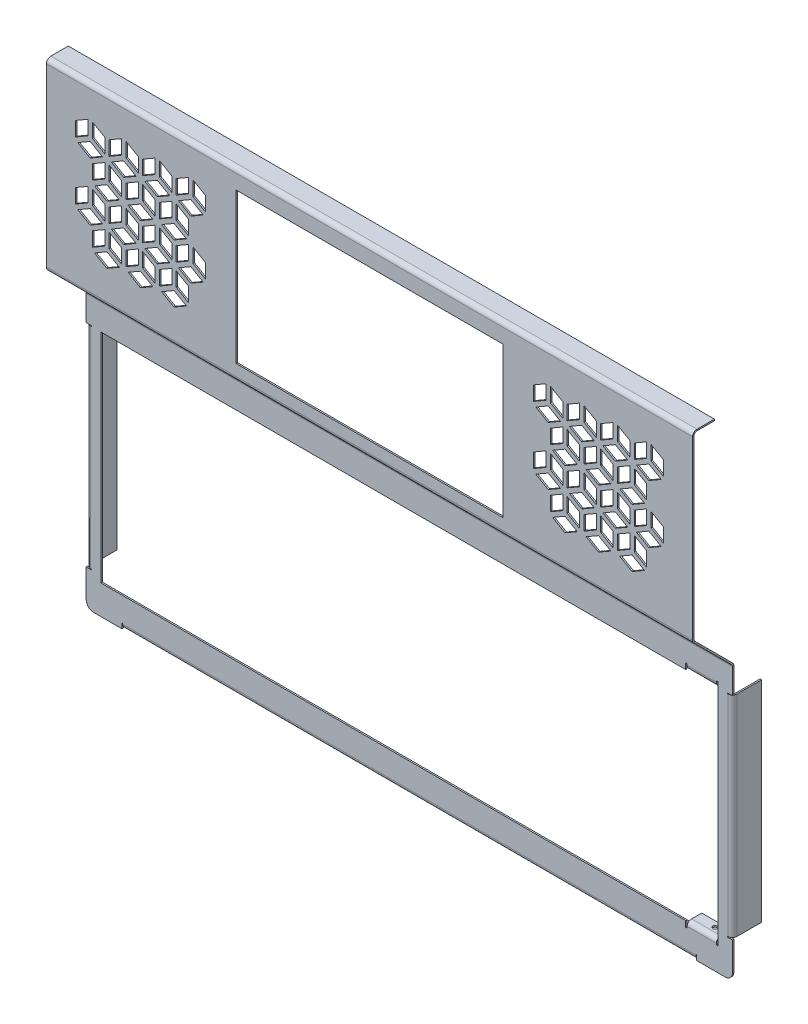
from build123d import *

# Parameters (mm, degrees)
SKETCH1_W                       = 423
SKETCH1_H                       = 149
BASE_FLANGE1_DEPTH              = 1
EDGE_FLANGE2_STRIP_W            = 8
EDGE_FLANGE2_STRIP_H            = 1
EDGE_FLANGE2_STRIP_CUT_DEPTH    = 393
EDGE_FLANGE2_RELIEF_W           = 8.5
EDGE_FLANGE2_RELIEF_H           = 0.5
EDGE_FLANGE2_RELIEF_CUT_DEPTH   = 1
EDGE_FLANGE2_STRIP_2_W          = 8
EDGE_FLANGE2_STRIP_2_H          = 1
EDGE_FLANGE2_STRIP_CUT_2_DEPTH  = 144
EDGE_FLANGE2_RELIEF_2_W         = 8.5
EDGE_FLANGE2_RELIEF_2_H         = 0.5
EDGE_FLANGE2_RELIEF_CUT_2_DEPTH = 1
EDGE_FLANGE2_STRIP_3_W          = 8
EDGE_FLANGE2_STRIP_3_H          = 1
EDGE_FLANGE2_STRIP_CUT_3_DEPTH  = 144
EDGE_FLANGE2_RELIEF_3_W         = 8.5
EDGE_FLANGE2_RELIEF_3_H         = 0.5
EDGE_FLANGE2_RELIEF_CUT_3_DEPTH = 1
EDGE_FLANGE2_DEPTH              = 393
EDGE_FLANGE2_BEND_DEPTH         = 144
EDGE_FLANGE2_BEND_2_DEPTH       = 144
EDGE_FLANGE4_STRIP_W            = 8
EDGE_FLANGE4_STRIP_H            = 1
EDGE_FLANGE4_STRIP_CUT_DEPTH    = 20
EDGE_FLANGE4_RELIEF_W           = 9
EDGE_FLANGE4_RELIEF_H           = 1
EDGE_FLANGE4_RELIEF_CUT_DEPTH   = 1
EDGE_FLANGE4_STRIP_2_W          = 8
EDGE_FLANGE4_STRIP_2_H          = 1
EDGE_FLANGE4_STRIP_CUT_2_DEPTH  = 20
EDGE_FLANGE4_RELIEF_2_W         = 9
EDGE_FLANGE4_RELIEF_2_H         = 1
EDGE_FLANGE4_RELIEF_CUT_2_DEPTH = 1
EDGE_FLANGE4_DEPTH              = 20
EDGE_FLANGE4_BEND_DEPTH         = 20
SKETCH36_R                      = 1.5
CUT_EXTRUDE2_DEPTH              = 458.48230284
EDGE_FLANGE5_START              = -18.747648903
EDGE_FLANGE5_DEPTH              = 443
EDGE_FLANGE5_2_DEPTH            = 443
EDGE_FLANGE6_START              = -18.747648903
EDGE_FLANGE6_DEPTH              = 443
EDGE_FLANGE6_2_DEPTH            = 443
EDGE_FLANGE7_STRIP_W            = 8
EDGE_FLANGE7_STRIP_H            = 1
EDGE_FLANGE7_STRIP_CUT_DEPTH    = 443
EDGE_FLANGE7_DEPTH              = 443
SKETCH60_W                      = 183
SKETCH60_H                      = 103
CUT_EXTRUDE3_DEPTH              = 515.968025923
CUT_EXTRUDE4_DEPTH              = 1


# Read off the part's stored shape, not the designer's step: Edge-Flange5, Edge-Flange6
# Sheet-metal steps are written as plain solids
with BuildPart() as part:
    # Sketch1 → Base-Flange1 (new body)
    with BuildSketch(Plane.XY):
        with BuildLine():
            Line((-18.747648903, 137.168495298), (424.252351097, 137.168495298))
            Line((424.252351097, 137.168495298), (424.252351097, -46.831504702))
            ThreePointArc((424.252351097, -46.831504702), (422.787885003, -50.367038608), (419.252351097, -51.831504702))
            Line((419.252351097, -51.831504702), (-13.747648903, -51.831504702))
            ThreePointArc((-13.747648903, -51.831504702), (-17.283182809, -50.367038608), (-18.747648903, -46.831504702))
            Line((-18.747648903, -46.831504702), (-18.747648903, 137.168495298))
        make_face()
        with Locations((202.752351097, 42.668495298)):
            Rectangle(SKETCH1_W, SKETCH1_H, mode=Mode.SUBTRACT)
    extrude(amount=-BASE_FLANGE1_DEPTH)

    # Edge-Flange2 strip (across the edge) → Edge-Flange2 strip cut (cut)
    with BuildSketch(Plane(origin=(399.252351097, -51.831504702, -1), x_dir=(0, 1, 0), z_dir=(-1, 0, 0))):
        with Locations((-1, -0.5)):
            Rectangle(EDGE_FLANGE2_STRIP_W, EDGE_FLANGE2_STRIP_H)
    extrude(amount=EDGE_FLANGE2_STRIP_CUT_DEPTH, mode=Mode.SUBTRACT)

    # Edge-Flange2 relief (on the sheet) → Edge-Flange2 relief cut (cut)
    with BuildSketch(Plane(origin=(399.252351097, -48.831504702, -1), x_dir=(0, 1, 0), z_dir=(0, 0, -1))):
        with Locations((-3.75, 0.25)):
            Rectangle(EDGE_FLANGE2_RELIEF_W, EDGE_FLANGE2_RELIEF_H)
        with Locations((-3.75, -393.25)):
            Rectangle(EDGE_FLANGE2_RELIEF_W, EDGE_FLANGE2_RELIEF_H)
    extrude(amount=-EDGE_FLANGE2_RELIEF_CUT_DEPTH, mode=Mode.SUBTRACT)

    # Edge-Flange2 strip 2 (across the edge) → Edge-Flange2 strip cut 2 (cut)
    with BuildSketch(Plane(origin=(-18.747648903, -26.831504702, -1), x_dir=(1, 0, 0), z_dir=(0, 1, 0))):
        with Locations((-1, -0.5)):
            Rectangle(EDGE_FLANGE2_STRIP_2_W, EDGE_FLANGE2_STRIP_2_H)
    extrude(amount=EDGE_FLANGE2_STRIP_CUT_2_DEPTH, mode=Mode.SUBTRACT)

    # Edge-Flange2 relief 2 (on the sheet) → Edge-Flange2 relief cut 2 (cut)
    with BuildSketch(Plane(origin=(-15.747648903, -26.831504702, -1), x_dir=(1, 0, 0), z_dir=(0, 0, -1))):
        with Locations((-3.75, 0.25)):
            Rectangle(EDGE_FLANGE2_RELIEF_2_W, EDGE_FLANGE2_RELIEF_2_H)
        with Locations((-3.75, -144.25)):
            Rectangle(EDGE_FLANGE2_RELIEF_2_W, EDGE_FLANGE2_RELIEF_2_H)
    extrude(amount=-EDGE_FLANGE2_RELIEF_CUT_2_DEPTH, mode=Mode.SUBTRACT)

    # Edge-Flange2 strip 3 (across the edge) → Edge-Flange2 strip cut 3 (cut)
    with BuildSketch(Plane(origin=(424.252351097, 117.168495298, -1), x_dir=(-1, 0, 0), z_dir=(0, -1, 0))):
        with Locations((-1, -0.5)):
            Rectangle(EDGE_FLANGE2_STRIP_3_W, EDGE_FLANGE2_STRIP_3_H)
    extrude(amount=EDGE_FLANGE2_STRIP_CUT_3_DEPTH, mode=Mode.SUBTRACT)

    # Edge-Flange2 relief 3 (on the sheet) → Edge-Flange2 relief cut 3 (cut)
    with BuildSketch(Plane(origin=(421.252351097, 117.168495298, -1), x_dir=(-1, 0, 0), z_dir=(0, 0, -1))):
        with Locations((-3.75, 0.25)):
            Rectangle(EDGE_FLANGE2_RELIEF_3_W, EDGE_FLANGE2_RELIEF_3_H)
        with Locations((-3.75, -144.25)):
            Rectangle(EDGE_FLANGE2_RELIEF_3_W, EDGE_FLANGE2_RELIEF_3_H)
    extrude(amount=-EDGE_FLANGE2_RELIEF_CUT_3_DEPTH, mode=Mode.SUBTRACT)

    # Edge-Flange2 section (across the edge) → Edge-Flange2 (add)
    with BuildSketch(Plane(origin=(399.252351097, -51.831504702, -1), x_dir=(0, 1, 0), z_dir=(-1, 0, 0))):
        with BuildLine():
            Line((0, 2), (0, 19))
            Line((0, 19), (1, 19))
            Line((1, 19), (1, 2))
            ThreePointArc((1, 2), (1.585786438, 0.585786438), (3, 0))
            Line((3, 0), (3, -1))
            ThreePointArc((3, -1), (0.878679656, -0.121320344), (0, 2))
        make_face()
    extrude(amount=EDGE_FLANGE2_DEPTH)

    # Edge-Flange2 section 2 (across the edge) → Edge-Flange2 bend (add)
    with BuildSketch(Plane(origin=(-18.747648903, -26.831504702, -1), x_dir=(1, 0, 0), z_dir=(0, 1, 0))):
        with BuildLine():
            Line((0, 2), (0, 19))
            Line((0, 19), (1, 19))
            Line((1, 19), (1, 2))
            ThreePointArc((1, 2), (1.585786438, 0.585786438), (3, 0))
            Line((3, 0), (3, -1))
            ThreePointArc((3, -1), (0.878679656, -0.121320344), (0, 2))
        make_face()
    extrude(amount=EDGE_FLANGE2_BEND_DEPTH)

    # Edge-Flange2 section 3 (across the edge) → Edge-Flange2 bend 2 (add)
    with BuildSketch(Plane(origin=(424.252351097, 117.168495298, -1), x_dir=(-1, 0, 0), z_dir=(0, -1, 0))):
        with BuildLine():
            Line((0, 2), (0, 19))
            Line((0, 19), (1, 19))
            Line((1, 19), (1, 2))
            ThreePointArc((1, 2), (1.585786438, 0.585786438), (3, 0))
            Line((3, 0), (3, -1))
            ThreePointArc((3, -1), (0.878679656, -0.121320344), (0, 2))
        make_face()
    extrude(amount=EDGE_FLANGE2_BEND_2_DEPTH)

    # Edge-Flange4 strip (across the edge) → Edge-Flange4 strip cut (cut)
    with BuildSketch(Plane(origin=(413.252351097, 117.168495298, -1), x_dir=(0, 1, 0), z_dir=(-1, 0, 0))):
        with Locations((-1, -0.5)):
            Rectangle(EDGE_FLANGE4_STRIP_W, EDGE_FLANGE4_STRIP_H)
    extrude(amount=EDGE_FLANGE4_STRIP_CUT_DEPTH, mode=Mode.SUBTRACT)

    # Edge-Flange4 relief (on the sheet) → Edge-Flange4 relief cut (cut)
    with BuildSketch(Plane(origin=(413.252351097, 120.168495298, -1), x_dir=(0, 1, 0), z_dir=(0, 0, -1))):
        with Locations((-3.5, 0.5)):
            Rectangle(EDGE_FLANGE4_RELIEF_W, EDGE_FLANGE4_RELIEF_H)
        with Locations((-3.5, -20.5)):
            Rectangle(EDGE_FLANGE4_RELIEF_W, EDGE_FLANGE4_RELIEF_H)
    extrude(amount=-EDGE_FLANGE4_RELIEF_CUT_DEPTH, mode=Mode.SUBTRACT)

    # Edge-Flange4 strip 2 (across the edge) → Edge-Flange4 strip cut 2 (cut)
    with BuildSketch(Plane(origin=(393.252351097, -31.831504702, -1), x_dir=(0, -1, 0), z_dir=(1, 0, 0))):
        with Locations((-1, -0.5)):
            Rectangle(EDGE_FLANGE4_STRIP_2_W, EDGE_FLANGE4_STRIP_2_H)
    extrude(amount=EDGE_FLANGE4_STRIP_CUT_2_DEPTH, mode=Mode.SUBTRACT)

    # Edge-Flange4 relief 2 (on the sheet) → Edge-Flange4 relief cut 2 (cut)
    with BuildSketch(Plane(origin=(393.252351097, -34.831504702, -1), x_dir=(0, -1, 0), z_dir=(0, 0, -1))):
        with Locations((-3.5, 0.5)):
            Rectangle(EDGE_FLANGE4_RELIEF_2_W, EDGE_FLANGE4_RELIEF_2_H)
        with Locations((-3.5, -20.5)):
            Rectangle(EDGE_FLANGE4_RELIEF_2_W, EDGE_FLANGE4_RELIEF_2_H)
    extrude(amount=-EDGE_FLANGE4_RELIEF_CUT_2_DEPTH, mode=Mode.SUBTRACT)

    # Edge-Flange4 section (across the edge) → Edge-Flange4 (add)
    with BuildSketch(Plane(origin=(413.252351097, 117.168495298, -1), x_dir=(0, 1, 0), z_dir=(-1, 0, 0))):
        with BuildLine():
            Line((0, 2), (0, 9))
            Line((0, 9), (1, 9))
            Line((1, 9), (1, 2))
            ThreePointArc((1, 2), (1.585786438, 0.585786438), (3, 0))
            Line((3, 0), (3, -1))
            ThreePointArc((3, -1), (0.878679656, -0.121320344), (0, 2))
        make_face()
    extrude(amount=EDGE_FLANGE4_DEPTH)

    # Edge-Flange4 section 2 (across the edge) → Edge-Flange4 bend (add)
    with BuildSketch(Plane(origin=(393.252351097, -31.831504702, -1), x_dir=(0, -1, 0), z_dir=(1, 0, 0))):
        with BuildLine():
            Line((0, 2), (0, 9))
            Line((0, 9), (1, 9))
            Line((1, 9), (1, 2))
            ThreePointArc((1, 2), (1.585786438, 0.585786438), (3, 0))
            Line((3, 0), (3, -1))
            ThreePointArc((3, -1), (0.878679656, -0.121320344), (0, 2))
        make_face()
    extrude(amount=EDGE_FLANGE4_BEND_DEPTH)

    # Sketch36 → Cut-Extrude2 (cut, through all)
    with BuildSketch(Plane(origin=(0, 118.168495298, 0), x_dir=(1, 0, 0), z_dir=(0, 1, 0))):
        with Locations(Location((406.252351097, 6, 0), (0, 0, 90))):
            Circle(SKETCH36_R)
    extrude(amount=-CUT_EXTRUDE2_DEPTH, mode=Mode.SUBTRACT)

    # Edge-Flange5 outline → Edge-Flange5 (cut)
    with BuildSketch(Plane.YZ.offset(EDGE_FLANGE5_START)):
        with BuildLine():
            Line((137.168495298, 0), (137.047174954, -0.121320344))
            ThreePointArc((137.047174954, -0.121320344), (136.073904908, -0.771638598), (134.925854611, -1))
            Line((134.925854611, -1), (137.168495298, -1))
            Line((137.168495298, -1), (137.168495298, 0))
        make_face()
    extrude(amount=EDGE_FLANGE5_DEPTH, mode=Mode.SUBTRACT)

    # Edge-Flange5 2 outline → Edge-Flange5 2 (add)
    with BuildSketch(Plane.YZ.offset(EDGE_FLANGE5_START)):
        with BuildLine():
            Line((134.925854611, 0), (137.168495298, 0))
            Line((137.168495298, 0), (164.452766545, 27.284271247))
            Line((164.452766545, 27.284271247), (163.745659764, 27.991378029))
            Line((163.745659764, 27.991378029), (136.340068173, 0.585786438))
            ThreePointArc((136.340068173, 0.585786438), (135.691221476, 0.152240935), (134.925854611, 0))
        make_face()
    extrude(amount=EDGE_FLANGE5_2_DEPTH)

    # Edge-Flange6 outline → Edge-Flange6 (cut)
    with BuildSketch(Plane.YZ.offset(EDGE_FLANGE6_START)):
        with BuildLine():
            ThreePointArc((162.159873326, 26.405591591), (163.133143373, 27.055909845), (164.28119367, 27.284271247))
            Line((164.28119367, 27.284271247), (164.452766545, 27.284271247))
            Line((164.452766545, 27.284271247), (163.745659764, 27.991378029))
            Line((163.745659764, 27.991378029), (162.159873326, 26.405591591))
        make_face()
    extrude(amount=EDGE_FLANGE6_DEPTH, mode=Mode.SUBTRACT)

    # Edge-Flange6 2 outline → Edge-Flange6 2 (add)
    with BuildSketch(Plane.YZ.offset(EDGE_FLANGE6_START)):
        with BuildLine():
            Line((288.038552983, 27.284271247), (164.452766545, 27.284271247))
            Line((164.452766545, 27.284271247), (162.866980108, 25.69848481))
            ThreePointArc((162.866980108, 25.69848481), (163.515826806, 26.132030312), (164.28119367, 26.284271247))
            Line((164.28119367, 26.284271247), (288.038552983, 26.284271247))
            Line((288.038552983, 26.284271247), (288.038552983, 27.284271247))
        make_face()
    extrude(amount=EDGE_FLANGE6_2_DEPTH)

    # Edge-Flange7 strip (across the edge) → Edge-Flange7 strip cut (cut)
    with BuildSketch(Plane(origin=(-18.747648903, 288.038552983, 26.284271247), x_dir=(0, -1, 0), z_dir=(1, 0, 0))):
        with Locations((-1, -0.5)):
            Rectangle(EDGE_FLANGE7_STRIP_W, EDGE_FLANGE7_STRIP_H)
    extrude(amount=EDGE_FLANGE7_STRIP_CUT_DEPTH, mode=Mode.SUBTRACT)

    # Edge-Flange7 section (across the edge) → Edge-Flange7 (add)
    with BuildSketch(Plane(origin=(-18.747648903, 288.038552983, 26.284271247), x_dir=(0, -1, 0), z_dir=(1, 0, 0))):
        with BuildLine():
            Line((0, 2), (0, 14))
            Line((0, 14), (1, 14))
            Line((1, 14), (1, 2))
            ThreePointArc((1, 2), (1.585786438, 0.585786438), (3, 0))
            Line((3, 0), (3, -1))
            ThreePointArc((3, -1), (0.878679656, -0.121320344), (0, 2))
        make_face()
    extrude(amount=EDGE_FLANGE7_DEPTH)

    # Sketch60 → Cut-Extrude3 (cut, through all)
    with BuildSketch(Plane.XY.offset(27.284271247)):
        with Locations((202.752351097, 223.538552983)):
            Rectangle(SKETCH60_W, SKETCH60_H)
    extrude(amount=-CUT_EXTRUDE3_DEPTH, mode=Mode.SUBTRACT)

    # Sketch61 → Cut-Extrude4 (cut)
    with BuildSketch(Plane.XY.offset(27.284271247)):
        Polygon((325.252351097, 244.036946531), (333.752351097, 248.944423819), (325.252351097, 253.851901107), (316.752351097, 248.944423819), align=None)
        Polygon((335.252351097, 251.542500031), (335.252351097, 261.357454607), (326.752351097, 266.264931895), (326.752351097, 256.449977319), align=None)
        Polygon((323.752351097, 266.264931895), (315.252351097, 261.357454607), (315.252351097, 251.542500031), (323.752351097, 256.449977319), align=None)
        Polygon((325.252351097, 204.199777957), (333.752351097, 209.107255245), (325.252351097, 214.014732533), (316.752351097, 209.107255245), align=None)
        Polygon((335.252351097, 211.705331457), (335.252351097, 221.520286033), (326.752351097, 226.427763321), (326.752351097, 216.612808745), align=None)
        Polygon((394.252351097, 244.036946531), (402.752351097, 248.944423819), (394.252351097, 253.851901107), (385.752351097, 248.944423819), align=None)
        Polygon((404.252351097, 251.542500031), (404.252351097, 261.357454607), (395.752351097, 266.264931895), (395.752351097, 256.449977319), align=None)
        Polygon((348.252351097, 244.036946531), (356.752351097, 248.944423819), (348.252351097, 253.851901107), (339.752351097, 248.944423819), align=None)
        Polygon((358.252351097, 251.542500031), (358.252351097, 261.357454607), (349.752351097, 266.264931895), (349.752351097, 256.449977319), align=None)
        Polygon((346.752351097, 266.264931895), (338.252351097, 261.357454607), (338.252351097, 251.542500031), (346.752351097, 256.449977319), align=None)
        Polygon((323.752351097, 226.427763321), (315.252351097, 221.520286033), (315.252351097, 211.705331457), (323.752351097, 216.612808745), align=None)
        Polygon((392.752351097, 266.264931895), (384.252351097, 261.357454607), (384.252351097, 251.542500031), (392.752351097, 256.449977319), align=None)
        Polygon((371.252351097, 244.036946531), (379.752351097, 248.944423819), (371.252351097, 253.851901107), (362.752351097, 248.944423819), align=None)
        Polygon((381.252351097, 251.542500031), (381.252351097, 261.357454607), (372.752351097, 266.264931895), (372.752351097, 256.449977319), align=None)
        Polygon((369.752351097, 266.264931895), (361.252351097, 261.357454607), (361.252351097, 251.542500031), (369.752351097, 256.449977319), align=None)
        Polygon((336.752351097, 184.28119367), (345.252351097, 189.188670958), (336.752351097, 194.096148246), (328.252351097, 189.188670958), align=None)
        Polygon((346.752351097, 191.786747169), (346.752351097, 201.601701746), (338.252351097, 206.509179034), (338.252351097, 196.694224458), align=None)
        Polygon((335.252351097, 206.509179034), (326.752351097, 201.601701746), (326.752351097, 191.786747169), (335.252351097, 196.694224458), align=None)
        Polygon((336.752351097, 224.118362244), (345.252351097, 229.025839532), (336.752351097, 233.93331682), (328.252351097, 229.025839532), align=None)
        Polygon((346.752351097, 231.623915744), (346.752351097, 241.43887032), (338.252351097, 246.346347608), (338.252351097, 236.531393032), align=None)
        Polygon((335.252351097, 246.346347608), (326.752351097, 241.43887032), (326.752351097, 231.623915744), (335.252351097, 236.531393032), align=None)
        Polygon((359.752351097, 224.118362244), (368.252351097, 229.025839532), (359.752351097, 233.93331682), (351.252351097, 229.025839532), align=None)
        Polygon((369.752351097, 231.623915744), (369.752351097, 241.43887032), (361.252351097, 246.346347608), (361.252351097, 236.531393032), align=None)
        Polygon((358.252351097, 246.346347608), (349.752351097, 241.43887032), (349.752351097, 231.623915744), (358.252351097, 236.531393032), align=None)
        Polygon((382.752351097, 224.118362244), (391.252351097, 229.025839532), (382.752351097, 233.93331682), (374.252351097, 229.025839532), align=None)
        Polygon((392.752351097, 231.623915744), (392.752351097, 241.43887032), (384.252351097, 246.346347608), (384.252351097, 236.531393032), align=None)
        Polygon((381.252351097, 246.346347608), (372.752351097, 241.43887032), (372.752351097, 231.623915744), (381.252351097, 236.531393032), align=None)
        Polygon((361.252351097, 221.520286033), (369.752351097, 226.427763321), (369.752351097, 216.612808745), (361.252351097, 211.705331457), align=None)
        Polygon((348.252351097, 204.199777957), (356.752351097, 209.107255245), (348.252351097, 214.014732533), (339.752351097, 209.107255245), align=None)
        Polygon((358.252351097, 211.705331457), (358.252351097, 221.520286033), (349.752351097, 226.427763321), (349.752351097, 216.612808745), align=None)
        Polygon((346.752351097, 226.427763321), (338.252351097, 221.520286033), (338.252351097, 211.705331457), (346.752351097, 216.612808745), align=None)
        Polygon((371.252351097, 204.199777957), (379.752351097, 209.107255245), (371.252351097, 214.014732533), (362.752351097, 209.107255245), align=None)
        Polygon((381.252351097, 211.705331457), (381.252351097, 221.520286033), (372.752351097, 226.427763321), (372.752351097, 216.612808745), align=None)
        Polygon((394.252351097, 204.199777957), (402.752351097, 209.107255245), (394.252351097, 214.014732533), (385.752351097, 209.107255245), align=None)
        Polygon((404.252351097, 211.705331457), (404.252351097, 221.520286033), (395.752351097, 226.427763321), (395.752351097, 216.612808745), align=None)
        Polygon((392.752351097, 226.427763321), (384.252351097, 221.520286033), (384.252351097, 211.705331457), (392.752351097, 216.612808745), align=None)
        Polygon((372.752351097, 201.601701746), (381.252351097, 206.509179034), (381.252351097, 196.694224458), (372.752351097, 191.786747169), align=None)
        Polygon((359.752351097, 184.28119367), (368.252351097, 189.188670958), (359.752351097, 194.096148246), (351.252351097, 189.188670958), align=None)
        Polygon((369.752351097, 191.786747169), (369.752351097, 201.601701746), (361.252351097, 206.509179034), (361.252351097, 196.694224458), align=None)
        Polygon((358.252351097, 206.509179034), (349.752351097, 201.601701746), (349.752351097, 191.786747169), (358.252351097, 196.694224458), align=None)
        Polygon((382.752351097, 184.28119367), (391.252351097, 189.188670958), (382.752351097, 194.096148246), (374.252351097, 189.188670958), align=None)
        Polygon((392.752351097, 191.786747169), (392.752351097, 201.601701746), (384.252351097, 206.509179034), (384.252351097, 196.694224458), align=None)
        Polygon((11.252351097, 244.036946531), (19.752351097, 248.944423819), (11.252351097, 253.851901107), (2.752351097, 248.944423819), align=None)
        Polygon((21.252351097, 251.542500031), (21.252351097, 261.357454607), (12.752351097, 266.264931895), (12.752351097, 256.449977319), align=None)
        Polygon((9.752351097, 266.264931895), (1.252351097, 261.357454607), (1.252351097, 251.542500031), (9.752351097, 256.449977319), align=None)
        Polygon((11.252351097, 204.199777957), (19.752351097, 209.107255245), (11.252351097, 214.014732533), (2.752351097, 209.107255245), align=None)
        Polygon((21.252351097, 211.705331457), (21.252351097, 221.520286033), (12.752351097, 226.427763321), (12.752351097, 216.612808745), align=None)
        Polygon((80.252351097, 244.036946531), (88.752351097, 248.944423819), (80.252351097, 253.851901107), (71.752351097, 248.944423819), align=None)
        Polygon((90.252351097, 251.542500031), (90.252351097, 261.357454607), (81.752351097, 266.264931895), (81.752351097, 256.449977319), align=None)
        Polygon((34.252351097, 244.036946531), (42.752351097, 248.944423819), (34.252351097, 253.851901107), (25.752351097, 248.944423819), align=None)
        Polygon((44.252351097, 251.542500031), (44.252351097, 261.357454607), (35.752351097, 266.264931895), (35.752351097, 256.449977319), align=None)
        Polygon((32.752351097, 266.264931895), (24.252351097, 261.357454607), (24.252351097, 251.542500031), (32.752351097, 256.449977319), align=None)
        Polygon((9.752351097, 226.427763321), (1.252351097, 221.520286033), (1.252351097, 211.705331457), (9.752351097, 216.612808745), align=None)
        Polygon((78.752351097, 266.264931895), (70.252351097, 261.357454607), (70.252351097, 251.542500031), (78.752351097, 256.449977319), align=None)
        Polygon((57.252351097, 244.036946531), (65.752351097, 248.944423819), (57.252351097, 253.851901107), (48.752351097, 248.944423819), align=None)
        Polygon((67.252351097, 251.542500031), (67.252351097, 261.357454607), (58.752351097, 266.264931895), (58.752351097, 256.449977319), align=None)
        Polygon((55.752351097, 266.264931895), (47.252351097, 261.357454607), (47.252351097, 251.542500031), (55.752351097, 256.449977319), align=None)
        Polygon((22.752351097, 184.28119367), (31.252351097, 189.188670958), (22.752351097, 194.096148246), (14.252351097, 189.188670958), align=None)
        Polygon((32.752351097, 191.786747169), (32.752351097, 201.601701746), (24.252351097, 206.509179034), (24.252351097, 196.694224458), align=None)
        Polygon((21.252351097, 206.509179034), (12.752351097, 201.601701746), (12.752351097, 191.786747169), (21.252351097, 196.694224458), align=None)
        Polygon((22.752351097, 224.118362244), (31.252351097, 229.025839532), (22.752351097, 233.93331682), (14.252351097, 229.025839532), align=None)
        Polygon((32.752351097, 231.623915744), (32.752351097, 241.43887032), (24.252351097, 246.346347608), (24.252351097, 236.531393032), align=None)
        Polygon((21.252351097, 246.346347608), (12.752351097, 241.43887032), (12.752351097, 231.623915744), (21.252351097, 236.531393032), align=None)
        Polygon((45.752351097, 224.118362244), (54.252351097, 229.025839532), (45.752351097, 233.93331682), (37.252351097, 229.025839532), align=None)
        Polygon((55.752351097, 231.623915744), (55.752351097, 241.43887032), (47.252351097, 246.346347608), (47.252351097, 236.531393032), align=None)
        Polygon((44.252351097, 246.346347608), (35.752351097, 241.43887032), (35.752351097, 231.623915744), (44.252351097, 236.531393032), align=None)
        Polygon((68.752351097, 224.118362244), (77.252351097, 229.025839532), (68.752351097, 233.93331682), (60.252351097, 229.025839532), align=None)
        Polygon((78.752351097, 231.623915744), (78.752351097, 241.43887032), (70.252351097, 246.346347608), (70.252351097, 236.531393032), align=None)
        Polygon((67.252351097, 246.346347608), (58.752351097, 241.43887032), (58.752351097, 231.623915744), (67.252351097, 236.531393032), align=None)
        Polygon((47.252351097, 221.520286033), (55.752351097, 226.427763321), (55.752351097, 216.612808745), (47.252351097, 211.705331457), align=None)
        Polygon((34.252351097, 204.199777957), (42.752351097, 209.107255245), (34.252351097, 214.014732533), (25.752351097, 209.107255245), align=None)
        Polygon((44.252351097, 211.705331457), (44.252351097, 221.520286033), (35.752351097, 226.427763321), (35.752351097, 216.612808745), align=None)
        Polygon((32.752351097, 226.427763321), (24.252351097, 221.520286033), (24.252351097, 211.705331457), (32.752351097, 216.612808745), align=None)
        Polygon((57.252351097, 204.199777957), (65.752351097, 209.107255245), (57.252351097, 214.014732533), (48.752351097, 209.107255245), align=None)
        Polygon((67.252351097, 211.705331457), (67.252351097, 221.520286033), (58.752351097, 226.427763321), (58.752351097, 216.612808745), align=None)
        Polygon((80.252351097, 204.199777957), (88.752351097, 209.107255245), (80.252351097, 214.014732533), (71.752351097, 209.107255245), align=None)
        Polygon((90.252351097, 211.705331457), (90.252351097, 221.520286033), (81.752351097, 226.427763321), (81.752351097, 216.612808745), align=None)
        Polygon((78.752351097, 226.427763321), (70.252351097, 221.520286033), (70.252351097, 211.705331457), (78.752351097, 216.612808745), align=None)
        Polygon((58.752351097, 201.601701746), (67.252351097, 206.509179034), (67.252351097, 196.694224458), (58.752351097, 191.786747169), align=None)
        Polygon((45.752351097, 184.28119367), (54.252351097, 189.188670958), (45.752351097, 194.096148246), (37.252351097, 189.188670958), align=None)
        Polygon((55.752351097, 191.786747169), (55.752351097, 201.601701746), (47.252351097, 206.509179034), (47.252351097, 196.694224458), align=None)
        Polygon((44.252351097, 206.509179034), (35.752351097, 201.601701746), (35.752351097, 191.786747169), (44.252351097, 196.694224458), align=None)
        Polygon((68.752351097, 184.28119367), (77.252351097, 189.188670958), (68.752351097, 194.096148246), (60.252351097, 189.188670958), align=None)
        Polygon((78.752351097, 191.786747169), (78.752351097, 201.601701746), (70.252351097, 206.509179034), (70.252351097, 196.694224458), align=None)
    extrude(amount=-CUT_EXTRUDE4_DEPTH, mode=Mode.SUBTRACT)


solid = part.part
